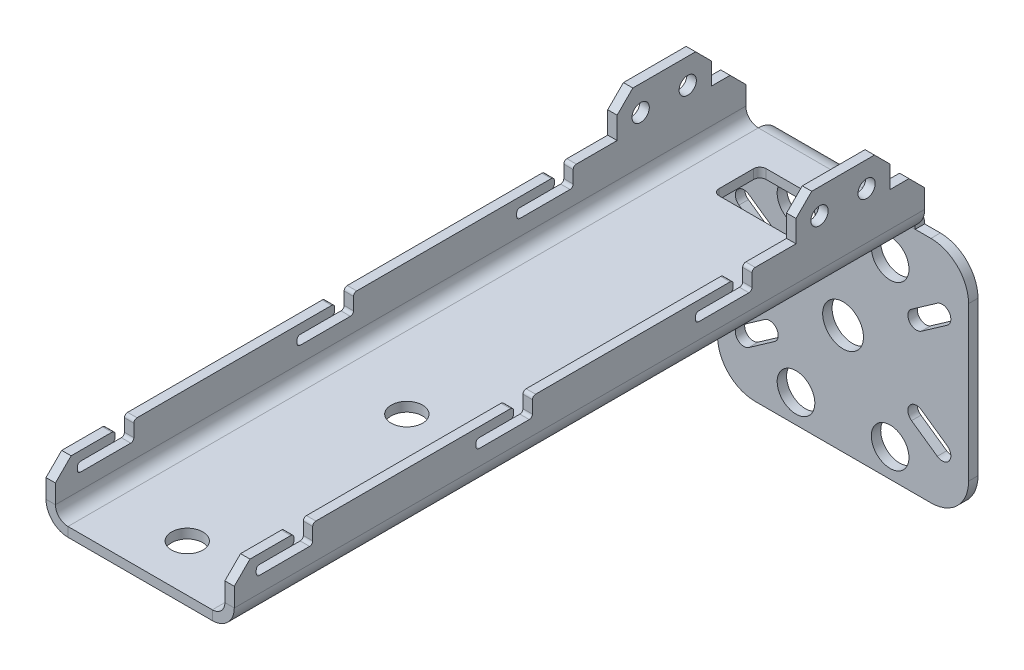
from build123d import *

# Parameters (mm, degrees)
ODGI_CIE_BAZOWE1_DEPTH           = 110
ODGI_CIE_START                   = -40
ODGI_CIE_KRAW_DZI1_OUTLINE_W     = 73
ODGI_CIE_KRAW_DZI1_OUTLINE_H     = 3
ODGI_CIE_KRAW_DZI1_DEPTH         = 80
ODGI_CIE_START_2                 = -23
ODGI_CIE_KRAW_DZI1_2_DEPTH       = 46
WYTNIJ_WYCI_GNI_CIE1_REACH       = 245.019
OTW_R_POD_RUB_M81_D              = 10
OTW_R_POD_RUB_M81_DEPTH          = 10
OTW_R_POD_RUB_M81_TIP            = 3.004303095
SZKIC19_W                        = 25
SZKIC19_H                        = 15
WYTNIJ_WYCI_GNI_CIE2_DEPTH       = 10
ZAOKR_GLENIE1_R                  = 2
WYTNIJ_WYCI_GNI_CIE3_REACH       = 245.019
SZKIC20_R                        = 6.5
WYTNIJ_WYCI_GNI_CIE4_DEPTH       = 157.582246759
ZAOKR_GLENIE2_R                  = 1
SZYK_LINIOWY1_COUNT              = 3
SZYK_LINIOWY1_PITCH              = 70
ZAOKR_GLENIE2_OF_SZYK_LINIOWY1_R = 1
SZKIC22_R                        = 6
WYTNIJ_WYCI_GNI_CIE5_DEPTH       = 244.018517813
ZAOKR_GLENIE3_R                  = 12
SZKIC23_W                        = 30
SZKIC23_H                        = 12
WYPUST2_DEPTH                    = 3
SFAZOWANIE1_SIZE                 = 5
OTW_R_POD_RUB_M52_D              = 5.5


# Read off the part's stored shape, not the designer's step: Odgięcie krawędzi1
# Sheet-metal steps are written as plain solids
with BuildPart() as part:
    # Szkic1 → Odgięcie bazowe1 (new, symmetric)
    with BuildSketch(Plane.XY):
        with BuildLine():
            Line((-30, 18), (-30, 7))
            ThreePointArc((-30, 7), (-27.949747468, 2.050252532), (-23, 0))
            Line((-23, 0), (23, 0))
            ThreePointArc((23, 0), (27.949747468, 2.050252532), (30, 7))
            Line((30, 7), (30, 18))
            Line((30, 18), (27, 18))
            Line((27, 18), (27, 7))
            ThreePointArc((27, 7), (25.828427125, 4.171572875), (23, 3))
            Line((23, 3), (-23, 3))
            ThreePointArc((-23, 3), (-25.828427125, 4.171572875), (-27, 7))
            Line((-27, 7), (-27, 18))
            Line((-27, 18), (-30, 18))
        make_face()
    extrude(amount=ODGI_CIE_BAZOWE1_DEPTH, both=True)



with BuildPart() as body_2:
    # Odgięcie krawędzi1 outline → Odgięcie krawędzi1 (new body)
    with BuildSketch(Plane.YZ.offset(ODGI_CIE_START)):
        with Locations((-40.5, -115.5)):
            Rectangle(ODGI_CIE_KRAW_DZI1_OUTLINE_W, ODGI_CIE_KRAW_DZI1_OUTLINE_H)
    extrude(amount=ODGI_CIE_KRAW_DZI1_DEPTH)


with BuildPart() as part_1:
    add(part.part)

    add(body_2.part)  # Odgi_cie kraw_dzi1 2 merges body 2
    # Odgi_cie kraw_dzi1 2 outline → Odgi_cie kraw_dzi1 2 (add)
    with BuildSketch(Plane.YZ.offset(ODGI_CIE_START_2)):
        with BuildLine():
            Line((-4, -114), (-4, -117))
            ThreePointArc((-4, -117), (0.949747468, -114.949747468), (3, -110))
            Line((3, -110), (0, -110))
            ThreePointArc((0, -110), (-1.171572875, -112.828427125), (-4, -114))
        make_face()
    extrude(amount=ODGI_CIE_KRAW_DZI1_2_DEPTH)

    # Szkic9 → Wytnij-wyciągnięcie1 (cut, up to next)
    with BuildSketch(Plane(origin=(0, 0, -117), x_dir=(-1, 0, 0), z_dir=(0, 0, -1)), mode=Mode.PRIVATE) as wytnij_wyci_gni_cie1_sk1:
        with BuildLine():
            Line((-30.018425021, -20.879449696), (-21.826904579, -26.61521406))
            ThreePointArc((-21.826904579, -26.61521406), (-21.151571657, -30.445217382), (-24.981574979, -31.120550304))
            Line((-24.981574979, -31.120550304), (-33.173095421, -25.38478594))
            ThreePointArc((-33.173095421, -25.38478594), (-33.848428343, -21.554782618), (-30.018425021, -20.879449696))
        make_face()
    wytnij_wyci_gni_cie1_tool1 = extrude(wytnij_wyci_gni_cie1_sk1.sketch, amount=-WYTNIJ_WYCI_GNI_CIE1_REACH, mode=Mode.PRIVATE) & part_1.part
    # Szkic9 → Wytnij-wyciągnięcie1 (cut, up to next)
    with BuildSketch(Plane(origin=(0, 0, -117), x_dir=(-1, 0, 0), z_dir=(0, 0, -1)), mode=Mode.PRIVATE) as wytnij_wyci_gni_cie1_sk2:
        with BuildLine():
            Line((30.018425021, -20.879449696), (21.826904579, -26.61521406))
            ThreePointArc((21.826904579, -26.61521406), (21.151571657, -30.445217382), (24.981574979, -31.120550304))
            Line((24.981574979, -31.120550304), (33.173095421, -25.38478594))
            ThreePointArc((33.173095421, -25.38478594), (33.848428343, -21.554782618), (30.018425021, -20.879449696))
        make_face()
    wytnij_wyci_gni_cie1_tool2 = extrude(wytnij_wyci_gni_cie1_sk2.sketch, amount=-WYTNIJ_WYCI_GNI_CIE1_REACH, mode=Mode.PRIVATE) & part_1.part
    # Szkic9 → Wytnij-wyciągnięcie1 (cut, up to next)
    with BuildSketch(Plane(origin=(0, 0, -117), x_dir=(-1, 0, 0), z_dir=(0, 0, -1)), mode=Mode.PRIVATE) as wytnij_wyci_gni_cie1_sk3:
        with BuildLine():
            Line((-30.018425021, -63.120550304), (-21.826904579, -57.38478594))
            ThreePointArc((-21.826904579, -57.38478594), (-21.151571657, -53.554782618), (-24.981574979, -52.879449696))
            Line((-24.981574979, -52.879449696), (-33.173095421, -58.61521406))
            ThreePointArc((-33.173095421, -58.61521406), (-33.848428343, -62.445217382), (-30.018425021, -63.120550304))
        make_face()
    wytnij_wyci_gni_cie1_tool3 = extrude(wytnij_wyci_gni_cie1_sk3.sketch, amount=-WYTNIJ_WYCI_GNI_CIE1_REACH, mode=Mode.PRIVATE) & part_1.part
    # Szkic9 → Wytnij-wyciągnięcie1 (cut, up to next)
    with BuildSketch(Plane(origin=(0, 0, -117), x_dir=(-1, 0, 0), z_dir=(0, 0, -1)), mode=Mode.PRIVATE) as wytnij_wyci_gni_cie1_sk4:
        with BuildLine():
            Line((30.018425021, -63.120550304), (21.826904579, -57.38478594))
            ThreePointArc((21.826904579, -57.38478594), (21.151571657, -53.554782618), (24.981574979, -52.879449696))
            Line((24.981574979, -52.879449696), (33.173095421, -58.61521406))
            ThreePointArc((33.173095421, -58.61521406), (33.848428343, -62.445217382), (30.018425021, -63.120550304))
        make_face()
    wytnij_wyci_gni_cie1_tool4 = extrude(wytnij_wyci_gni_cie1_sk4.sketch, amount=-WYTNIJ_WYCI_GNI_CIE1_REACH, mode=Mode.PRIVATE) & part_1.part
    add(wytnij_wyci_gni_cie1_tool1.solids().sort_by_distance((27.5, -26, -117))[0], mode=Mode.SUBTRACT)
    add(wytnij_wyci_gni_cie1_tool2.solids().sort_by_distance((-27.5, -26, -117))[0], mode=Mode.SUBTRACT)
    add(wytnij_wyci_gni_cie1_tool3.solids().sort_by_distance((27.5, -58, -117))[0], mode=Mode.SUBTRACT)
    add(wytnij_wyci_gni_cie1_tool4.solids().sort_by_distance((-27.5, -58, -117))[0], mode=Mode.SUBTRACT)

    # Otwór pod śrubę M81
    with Locations(Plane(origin=(0, 3, 0), x_dir=(1, 0, 0), z_dir=(0, 1, 0))):
        with Locations((0, -95), (0, -25)):
            Hole(OTW_R_POD_RUB_M81_D / 2, depth=OTW_R_POD_RUB_M81_DEPTH)
            with Locations((0, 0, -(OTW_R_POD_RUB_M81_DEPTH + OTW_R_POD_RUB_M81_TIP / 2))):  # 118° drill point
                Cone(0, OTW_R_POD_RUB_M81_D / 2, OTW_R_POD_RUB_M81_TIP, mode=Mode.SUBTRACT)

    # Szkic19 → Wytnij-wyciągnięcie2 (cut)
    with BuildSketch(Plane(origin=(0, 3, 0), x_dir=(1, 0, 0), z_dir=(0, 1, 0))):
        with Locations((0, 92.5)):
            Rectangle(SZKIC19_W, SZKIC19_H)
    extrude(amount=-WYTNIJ_WYCI_GNI_CIE2_DEPTH, mode=Mode.SUBTRACT)

    # Zaokrąglenie1
    zaokr_glenie1_edges = [part_1.edges().sort_by_distance(p)[0] for p in [
        (-12.5, 1.5, -85),
        (-12.5, 1.5, -100),
        (12.5, 1.5, -100),
        (12.5, 1.5, -85),
    ]]
    fillet(zaokr_glenie1_edges, radius=ZAOKR_GLENIE1_R)

    # Szkic20 → Wytnij-wyciągnięcie3 (cut, up to next)
    with BuildSketch(Plane(origin=(0, 0, -117), x_dir=(-1, 0, 0), z_dir=(0, 0, -1)), mode=Mode.PRIVATE) as wytnij_wyci_gni_cie3_sk1:
        with Locations(Location((0, -42, 0), (0, 0, 90))):
            Circle(SZKIC20_R)
    wytnij_wyci_gni_cie3_tool1 = extrude(wytnij_wyci_gni_cie3_sk1.sketch, amount=-WYTNIJ_WYCI_GNI_CIE3_REACH, mode=Mode.PRIVATE) & part_1.part
    add(wytnij_wyci_gni_cie3_tool1.solids().sort_by_distance((0, -42, -117))[0], mode=Mode.SUBTRACT)

    # Szkic21 → Wytnij-wyciągnięcie4 (cut, through all)
    with BuildSketch(Plane.ZY.offset(30)):
        Polygon((-55, 18), (-55, 12), (-37, 12), (-37, 15), (-49, 15), (-49, 18), align=None)
    wytnij_wyci_gni_cie4 = extrude(amount=-WYTNIJ_WYCI_GNI_CIE4_DEPTH, mode=Mode.SUBTRACT)

    # Zaokrąglenie2
    zaokr_glenie2_edges = [part_1.edges().sort_by_distance(p)[0] for p in [
        (28.5, 18, -55),
        (28.5, 18, -49),
        (28.5, 15, -49),
        (28.5, 15, -37),
        (28.5, 12, -37),
        (28.5, 12, -55),
        (-28.5, 18, -55),
        (-28.5, 18, -49),
        (-28.5, 15, -49),
        (-28.5, 15, -37),
        (-28.5, 12, -37),
        (-28.5, 12, -55),
    ]]
    fillet(zaokr_glenie2_edges, radius=ZAOKR_GLENIE2_R)

    # Szyk liniowy1: Wytnij-wyciągnięcie4 ×3
    with Locations(*[(0, 0, i * SZYK_LINIOWY1_PITCH) for i in range(1, SZYK_LINIOWY1_COUNT)]):
        add(wytnij_wyci_gni_cie4, mode=Mode.SUBTRACT)

    # Zaokrąglenie2 of Szyk liniowy1
    zaokr_glenie2_of_szyk_liniowy1_edges = [part_1.edges().sort_by_distance(p)[0] for p in [
        (28.5, 18, 15),
        (28.5, 18, 21),
        (28.5, 15, 21),
        (28.5, 15, 33),
        (28.5, 12, 33),
        (28.5, 12, 15),
        (-28.5, 18, 15),
        (-28.5, 18, 21),
        (-28.5, 15, 21),
        (-28.5, 15, 33),
        (-28.5, 12, 33),
        (-28.5, 12, 15),
        (28.5, 18, 85),
        (28.5, 18, 91),
        (28.5, 15, 91),
        (28.5, 15, 103),
        (28.5, 12, 103),
        (28.5, 12, 85),
        (-28.5, 18, 85),
        (-28.5, 18, 91),
        (-28.5, 15, 91),
        (-28.5, 15, 103),
        (-28.5, 12, 103),
        (-28.5, 12, 85),
    ]]
    fillet(zaokr_glenie2_of_szyk_liniowy1_edges, radius=ZAOKR_GLENIE2_OF_SZYK_LINIOWY1_R)

    # Szkic22 → Wytnij-wyciągnięcie5 (cut, through all)
    with BuildSketch(Plane(origin=(0, 0, -117), x_dir=(-1, 0, 0), z_dir=(0, 0, -1))):
        with Locations(Location((-15, -16, 0), (0, 0, 90))):
            Circle(SZKIC22_R)
        with Locations(Location((15, -16, 0), (0, 0, 90))):
            Circle(SZKIC22_R)
        with Locations(Location((-15, -68, 0), (0, 0, 90))):
            Circle(SZKIC22_R)
        with Locations(Location((15, -68, 0), (0, 0, 90))):
            Circle(SZKIC22_R)
    extrude(amount=-WYTNIJ_WYCI_GNI_CIE5_DEPTH, mode=Mode.SUBTRACT)

    # Zaokrąglenie3
    zaokr_glenie3_edges = [part_1.edges().sort_by_distance(p)[0] for p in [
        (40, -4, -115.5),
        (-40, -4, -115.5),
        (-40, -77, -115.5),
        (40, -77, -115.5),
    ]]
    fillet(zaokr_glenie3_edges, radius=ZAOKR_GLENIE3_R)

    # Szkic23 → Wypust2 (add)
    with BuildSketch(Plane.ZY.offset(30)):
        with Locations((-84, 24)):
            Rectangle(SZKIC23_W, SZKIC23_H)
    wypust2 = extrude(amount=-WYPUST2_DEPTH)

    # Lustro2: Wypust2 across plane
    add(wypust2.mirror(Plane(origin=(0, 0, 0), x_dir=(0, 0, 1), z_dir=(1, 0, 0))))

    # Sfazowanie1
    sfazowanie1_edges = [part_1.edges().sort_by_distance(p)[0] for p in [
        (-28.5, 18, -110),
        (28.5, 18, -110),
        (-28.5, 18, 110),
        (-28.5, 30, -99),
        (-28.5, 30, -69),
        (28.5, 18, 110),
        (28.5, 30, -99),
        (28.5, 30, -69),
    ]]
    chamfer(sfazowanie1_edges, length=SFAZOWANIE1_SIZE)

    # Otwór pod śrubę M52 (through all)
    with Locations(Plane.ZY.offset(30)):
        with Locations((-91.5, 22), (-76.5, 22)):
            Hole(OTW_R_POD_RUB_M52_D / 2)


solid = part_1.part
